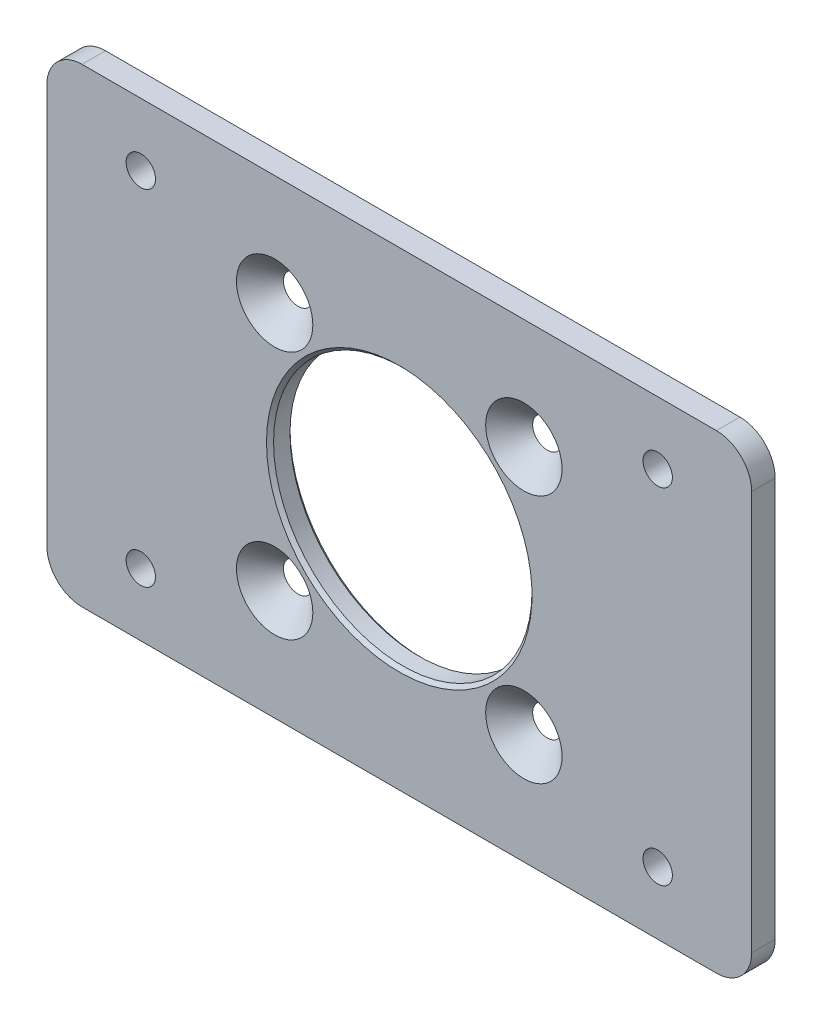
from build123d import *

# Parameters (mm, degrees)
SZKIC1_R                    = 11
SZKIC1_R_2                  = 1.25
DODANIE_WYCI_GNI_CIE1_DEPTH = 2
SFAZOWANIE1_SIZE            = 0.3
SFAZOWANIE2_SIZE            = 2


with BuildPart() as part:
    # Szkic1 → Dodanie-wyciągnięcie1 (new body)
    with BuildSketch(Plane.XY):
        with BuildLine():
            Line((-27, -20), (27, -20))
            ThreePointArc((27, -20), (29.121320344, -19.121320344), (30, -17))
            Line((30, -17), (30, 17))
            ThreePointArc((30, 17), (29.121320344, 19.121320344), (27, 20))
            Line((27, 20), (-27, 20))
            ThreePointArc((-27, 20), (-29.121320344, 19.121320344), (-30, 17))
            Line((-30, 17), (-30, -17))
            ThreePointArc((-30, -17), (-29.121320344, -19.121320344), (-27, -20))
        make_face()
        Circle(SZKIC1_R, mode=Mode.SUBTRACT)
        with Locations((-22, 14.666666667)):
            Circle(SZKIC1_R_2, mode=Mode.SUBTRACT)
        with Locations((22, 14.666666667)):
            Circle(SZKIC1_R_2, mode=Mode.SUBTRACT)
        with Locations((22, -14.666666667)):
            Circle(SZKIC1_R_2, mode=Mode.SUBTRACT)
        with Locations((-10.606601718, -10.606601718)):
            Circle(SZKIC1_R_2, mode=Mode.SUBTRACT)
        with Locations((10.606601718, -10.606601718)):
            Circle(SZKIC1_R_2, mode=Mode.SUBTRACT)
        with Locations((10.606601718, 10.606601718)):
            Circle(SZKIC1_R_2, mode=Mode.SUBTRACT)
        with Locations((-10.606601718, 10.606601718)):
            Circle(SZKIC1_R_2, mode=Mode.SUBTRACT)
        with Locations((-22, -14.666666667)):
            Circle(SZKIC1_R_2, mode=Mode.SUBTRACT)
    extrude(amount=DODANIE_WYCI_GNI_CIE1_DEPTH)

    # Sfazowanie1
    sfazowanie1_edges = [part.edges().sort_by_distance(p)[0] for p in [
        (-11, 0, 0),
        (-11, 0, 2),
    ]]
    chamfer(sfazowanie1_edges, length=SFAZOWANIE1_SIZE)

    # Sfazowanie2
    sfazowanie2_edges = [part.edges().sort_by_distance(p)[0] for p in [
        (-11.856601718, -10.606601718, 2),
        (9.356601718, -10.606601718, 2),
        (9.356601718, 10.606601718, 2),
        (-11.856601718, 10.606601718, 2),
    ]]
    chamfer(sfazowanie2_edges, length=SFAZOWANIE2_SIZE - 0.0001)  # a hair under: the kernel refuses the full size


solid = part.part
